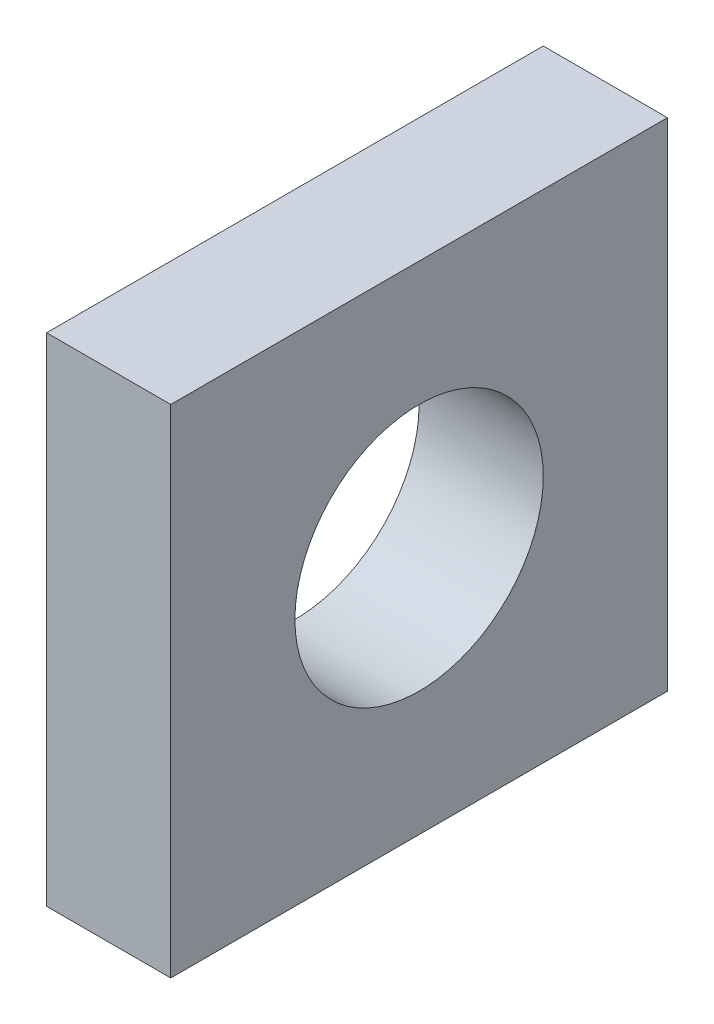
from build123d import *

# Parameters (mm, degrees)
SKETCH2_W           = 38.1
SKETCH2_H           = 38.1
SKETCH2_R           = 9.525
BOSS_EXTRUDE1_DEPTH = 9.525
SKETCH3_R           = 2
CUT_EXTRUDE1_DEPTH  = 9.525


with BuildPart() as part:
    # Sketch2 → Boss-Extrude1 (new body)
    with BuildSketch(Plane(origin=(0, 0, 0), x_dir=(0, 0, -1), z_dir=(1, 0, 0))):
        with Locations((19.05, 19.05)):
            Rectangle(SKETCH2_W, SKETCH2_H)
        with Locations((19.05, 19.05)):
            Circle(SKETCH2_R, mode=Mode.SUBTRACT)
    extrude(amount=BOSS_EXTRUDE1_DEPTH)

    # Sketch3 → Cut-Extrude1 (cut)
    with BuildSketch(Plane(origin=(0, 0, -38.1), x_dir=(-1, 0, 0), z_dir=(0, 0, -1))):
        with Locations((-4.7625, 34.1)):
            Circle(SKETCH3_R)
        with Locations((-4.7625, 4)):
            Circle(SKETCH3_R)
    extrude(amount=-CUT_EXTRUDE1_DEPTH, mode=Mode.SUBTRACT)


solid = part.part
